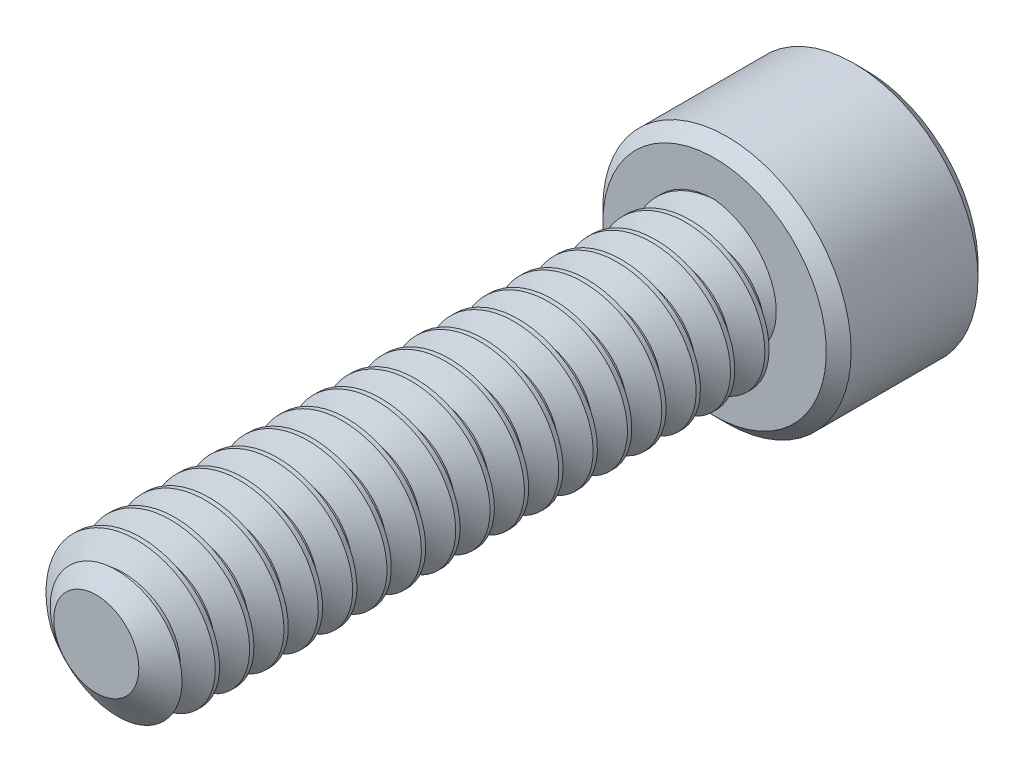
from build123d import *

# Parameters (mm, degrees)
SKETCH1_R          = 1.7526
EXTRUDE1_DEPTH     = 14.2875
CUT_SWEEP1_PITCH   = 0.79375
SKETCH6_R          = 2.8702
EXTRUDE2_DEPTH     = 3.5052
CUT_EXTRUDE1_DEPTH = 2.08359375
CHAMFER1_SIZE      = 0.28702


with BuildPart() as part:
    # Sketch1 → Extrude1 (new body)
    with BuildSketch(Plane.XY):
        Circle(SKETCH1_R)
    extrude(amount=-EXTRUDE1_DEPTH)

    # Cut-Sweep1: the profile of Sketch3 profile screwed along a right-hand helix of 19 turns, 6 arcs to a turn; built about Z, then put on its axis
    cut_sweep1_z = Axis((0, 0, 0), (0, 0, 1))
    cut_sweep1_corners = [(1.7529, 0, -0.694704455), (1.237044252, 0, -0.396875), (1.237044252, 0, -0.29765625), (1.7529, 0, 0.000173205)]
    with BuildLine(mode=Mode.PRIVATE) as cut_sweep1_profile:
        Line(cut_sweep1_corners[0], cut_sweep1_corners[1])
        Line(cut_sweep1_corners[1], cut_sweep1_corners[2])
        Line(cut_sweep1_corners[2], cut_sweep1_corners[3])
        Line(cut_sweep1_corners[3], cut_sweep1_corners[0])
    cut_sweep1_cap = Face(cut_sweep1_profile.wire())
    cut_sweep1_turn_angles = [0, 30, 60, 90, 120, 150, 180, 210, 240, 270, 300, 330, 360]
    cut_sweep1_turn_weights = [1, 0.8660254037844387, 1, 0.8660254037844387, 1, 0.8660254037844387, 1, 0.8660254037844387, 1, 0.8660254037844387, 1, 0.8660254037844387, 1]
    cut_sweep1_turn_rails = [Edge.make_bspline([Vector(p[0], p[1], 0).rotate(cut_sweep1_z, cut_sweep1_turn_angles[k]) / cut_sweep1_turn_weights[k] + Vector(0, 0, p[2] + CUT_SWEEP1_PITCH * cut_sweep1_turn_angles[k] / 360) for k in range(13)], [0, 0, 0, 1, 1, 2, 2, 3, 3, 4, 4, 5, 5, 6, 6, 6], 2, cut_sweep1_turn_weights) for p in cut_sweep1_corners]
    cut_sweep1_turn_sides = [Face.make_surface_from_curves(cut_sweep1_turn_rails[p[0]], cut_sweep1_turn_rails[p[1]]) for p in [(0, 1), (1, 2), (2, 3), (3, 0)]]
    cut_sweep1 = Plane(origin=(0, 0, 0), x_dir=(0, 1, 0), z_dir=(0, 0, -1)) * Solid(Shell([*[p.moved(Location((0, 0, CUT_SWEEP1_PITCH * i))) for i in range(19) for p in cut_sweep1_turn_sides], cut_sweep1_cap, cut_sweep1_cap.rotate(cut_sweep1_z, 6840).moved(Location((0, 0, CUT_SWEEP1_PITCH * 6840 / 360)))]))
    add(cut_sweep1, mode=Mode.SUBTRACT)

    # Sketch4 → Cut-Revolve1 (revolve, cut)
    with BuildSketch(Plane(origin=(0, 0, 0), x_dir=(0, 0, -1), z_dir=(1, 0, 0)), mode=Mode.PRIVATE) as cut_revolve1_sk:
        Polygon((0.538848736, 1.7526), (0, 0.983044252), (0, 1.7526), align=None)
    revolve(cut_revolve1_sk.sketch.rotate(Axis((0, 0, 0), (0, 0, -1)), 261.048315518), axis=Axis((0, 0, 0), (0, 0, -1)), mode=Mode.SUBTRACT)

    # Sketch6 → Extrude2 (add)
    with BuildSketch(Plane(origin=(0, 0, -14.2875), x_dir=(-1, 0, 0), z_dir=(0, 0, -1))):
        Circle(SKETCH6_R)
    extrude(amount=EXTRUDE2_DEPTH)

    # Sketch7 → Cut-Extrude1 (cut)
    with BuildSketch(Plane(origin=(0, 0, -17.7927), x_dir=(-1, 0, 0), z_dir=(0, 0, -1))):
        Polygon((0, 1.603951217), (-1.3890625, 0.801975608), (-1.3890625, -0.801975608), (0, -1.603951217), (1.3890625, -0.801975608), (1.3890625, 0.801975608), align=None)
    extrude(amount=-CUT_EXTRUDE1_DEPTH, mode=Mode.SUBTRACT)

    # Cut-Extrude2 cone 1 section (through the dimple's axis) → Cut-Extrude2 (revolve, cut)
    with BuildSketch(Plane(origin=(0, 0, -17.7927), x_dir=(0, 1, 0), z_dir=(1, 0, 0))):
        Polygon((0, 0), (1.603951217, 0), (0, 1.603951217), align=None)
    revolve(axis=Axis((0, 0, -17.7927), (0, 0, 1)), mode=Mode.SUBTRACT)

    # Chamfer1
    chamfer1_edges = [part.edges().sort_by_distance(p)[0] for p in [
        (2.8702, 0, -14.2875),
        (2.8702, 0, -17.7927),
    ]]
    chamfer(chamfer1_edges, length=CHAMFER1_SIZE)


solid = part.part
